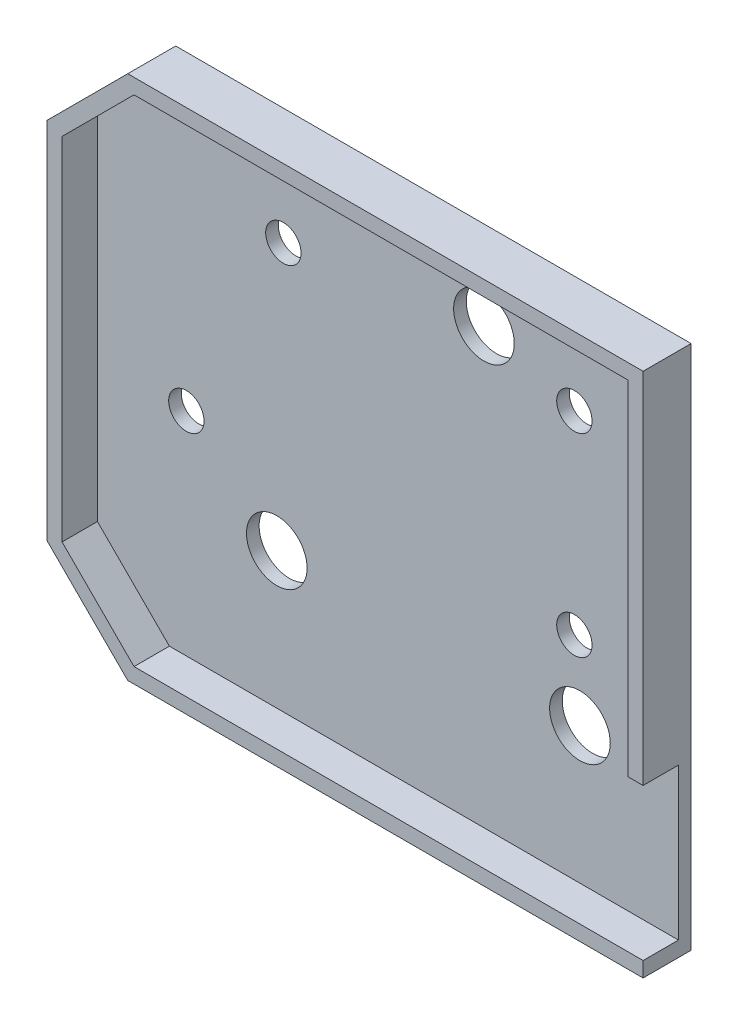
from build123d import *

# Parameters (mm, degrees)
BOSS_EXTRU_1_DEPTH      = 2.5
BOSS_EXTRU_2_DEPTH      = 7
ESQUISSE3_R             = 6
ESQUISSE3_R_2           = 3.5
ENL_V_MAT_EXTRU_1_DEPTH = 10


with BuildPart() as part:
    # Esquisse1 → Boss.-Extru.1 (new body)
    with BuildSketch(Plane.XY):
        Polygon((0, -85), (16, -101), (118, -101), (118, 3), (16, 3), (0, -13), align=None)
    extrude(amount=BOSS_EXTRU_1_DEPTH)

    # Esquisse2 → Boss.-Extru.2 (add)
    with BuildSketch(Plane.XY.offset(2.5)):
        Polygon((3, -83.757359313), (17.242640687, -98), (115, -98), (118, -98), (118, -101), (16, -101), (0, -85), (0, -13), (16, 3), (118, 3), (118, -2.5), (118, -68), (115, -68), (115, 0), (17.242640687, 0), (3, -14.242640687), align=None)
    extrude(amount=BOSS_EXTRU_2_DEPTH)

    # Esquisse3 → Enlèv. mat.-Extru.1 (cut)
    with BuildSketch(Plane.XY.offset(2.5)):
        with Locations((98.5, -71)):
            Circle(ESQUISSE3_R)
        with Locations((79.5, -12)):
            Circle(ESQUISSE3_R)
        with Locations((38.5, -71)):
            Circle(ESQUISSE3_R)
        with Locations((97.4, -17.6)):
            Circle(ESQUISSE3_R_2)
        with Locations((39.8, -17.6)):
            Circle(ESQUISSE3_R_2)
        with Locations((20.6, -56)):
            Circle(ESQUISSE3_R_2)
        with Locations((97.4, -56)):
            Circle(ESQUISSE3_R_2)
    extrude(amount=-ENL_V_MAT_EXTRU_1_DEPTH, mode=Mode.SUBTRACT)


solid = part.part
